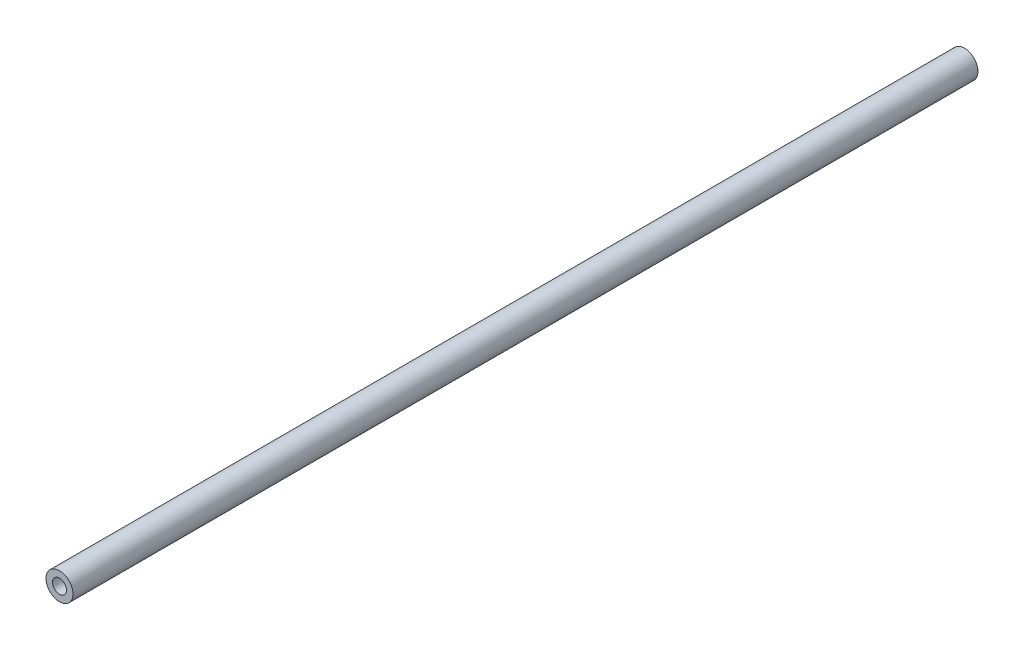
from build123d import *

# Parameters (mm, degrees)
SKETCH1_R                      = 5
BOSS_EXTRUDE1_DEPTH            = 335
F_6_0_204_DIAMETER_HOLE1_D     = 5.1816
F_6_0_204_DIAMETER_HOLE1_DEPTH = 30
F_6_0_204_DIAMETER_HOLE1_TIP   = 1.556709692
F_6_0_204_DIAMETER_HOLE2_D     = 5.1816
F_6_0_204_DIAMETER_HOLE2_DEPTH = 30
F_6_0_204_DIAMETER_HOLE2_TIP   = 1.556709692


with BuildPart() as part:
    # Sketch1 → Boss-Extrude1 (new body)
    with BuildSketch(Plane.XY):
        Circle(SKETCH1_R)
    extrude(amount=BOSS_EXTRUDE1_DEPTH)

    # #6 (0.204) Diameter Hole1
    with Locations(Plane(origin=(0, 0, 0), x_dir=(-1, 0, 0), z_dir=(0, 0, -1))):
        with Locations((0, 0)):
            Hole(F_6_0_204_DIAMETER_HOLE1_D / 2, depth=F_6_0_204_DIAMETER_HOLE1_DEPTH)
            with Locations((0, 0, -(F_6_0_204_DIAMETER_HOLE1_DEPTH + F_6_0_204_DIAMETER_HOLE1_TIP / 2))):  # 118° drill point
                Cone(0, F_6_0_204_DIAMETER_HOLE1_D / 2, F_6_0_204_DIAMETER_HOLE1_TIP, mode=Mode.SUBTRACT)

    # #6 (0.204) Diameter Hole2
    with Locations(Plane.XY.offset(335)):
        with Locations((0, 0)):
            Hole(F_6_0_204_DIAMETER_HOLE2_D / 2, depth=F_6_0_204_DIAMETER_HOLE2_DEPTH)
            with Locations((0, 0, -(F_6_0_204_DIAMETER_HOLE2_DEPTH + F_6_0_204_DIAMETER_HOLE2_TIP / 2))):  # 118° drill point
                Cone(0, F_6_0_204_DIAMETER_HOLE2_D / 2, F_6_0_204_DIAMETER_HOLE2_TIP, mode=Mode.SUBTRACT)


solid = part.part
